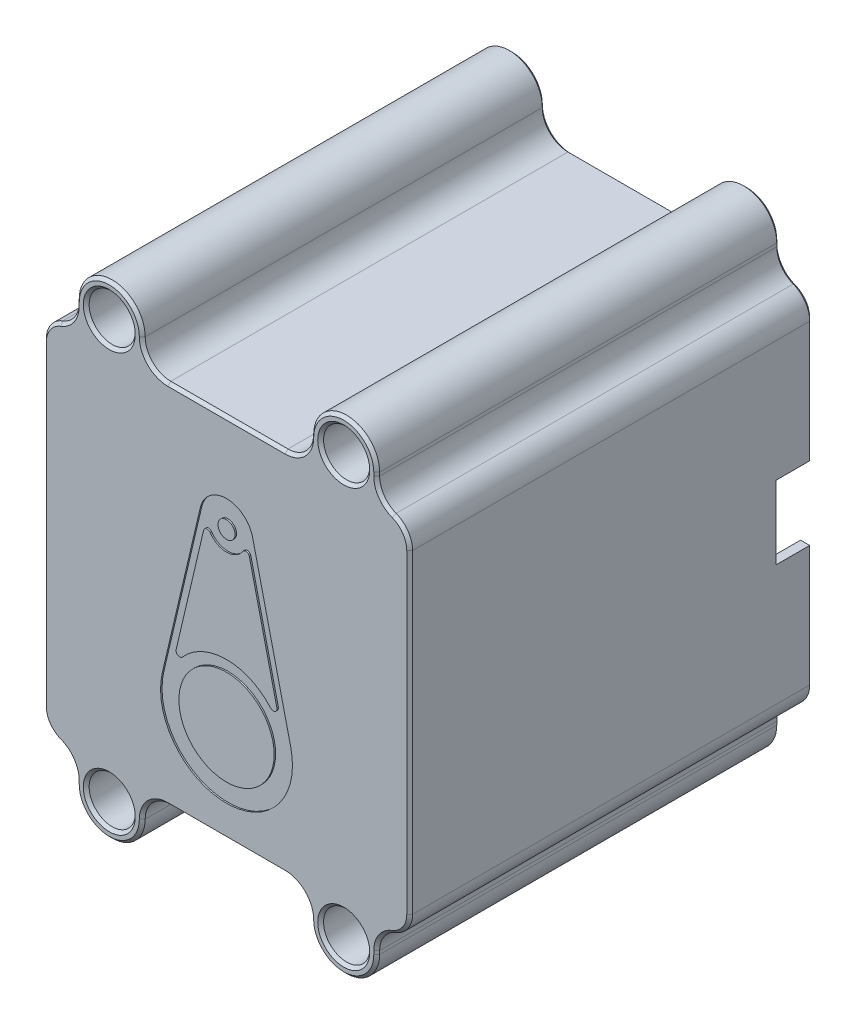
from build123d import *

# Parameters (mm, degrees)
SKIZZE1_W                       = 50
SKIZZE1_H                       = 50
SKIZZE1_W_2                     = 47.5
SKIZZE1_H_2                     = 47.5
AUFSATZ_LINEAR_AUSTRAGEN1_DEPTH = 55
SKIZZE2_W                       = 50
SKIZZE2_H                       = 50
AUFSATZ_LINEAR_AUSTRAGEN2_DEPTH = 1
VERRUNDUNG1_R                   = 3.5
SKIZZE3_W                       = 5
SKIZZE3_H                       = 10
SCHNITT_LINEAR_AUSTRAGEN1_DEPTH = 2
FASE1_SIZE                      = 1
AUFSATZ_LINEAR_START            = -55
SKIZZE4_R                       = 1.8
AUFSATZ_LINEAR_AUSTRAGEN3_DEPTH = 55
SKIZZE5_R                       = 3.15
SCHNITT_LINEAR_AUSTRAGEN2_DEPTH = 49
FASE3_SIZE                      = 0.67
VERRUNDUNG2_R                   = 3.5
FASE2_SIZE                      = 0.4
SKIZZE6_R                       = 6.5
SKIZZE6_R_2                     = 1.166666667
SCHNITT_LINEAR_AUSTRAGEN4_DEPTH = 0.2
VERRUNDUNG3_R                   = 0.5


with BuildPart() as part:
    # Skizze1 → Aufsatz-Linear austragen1 (new body)
    with BuildSketch(Plane.XY):
        Rectangle(SKIZZE1_W, SKIZZE1_H)
        Rectangle(SKIZZE1_W_2, SKIZZE1_H_2, mode=Mode.SUBTRACT)
    extrude(amount=AUFSATZ_LINEAR_AUSTRAGEN1_DEPTH)

    # Skizze2 → Aufsatz-Linear austragen2 (add)
    with BuildSketch(Plane.XY.offset(55)):
        Rectangle(SKIZZE2_W, SKIZZE2_H)
    extrude(amount=-AUFSATZ_LINEAR_AUSTRAGEN2_DEPTH)

    # Verrundung1
    verrundung1_edges = [part.edges().sort_by_distance(p)[0] for p in [
        (-23.75, -23.75, 27),
        (23.75, -23.75, 27),
        (-23.75, 23.75, 27),
        (23.75, 23.75, 27),
        (25, -25, 27.5),
        (-25, -25, 27.5),
        (-25, 25, 27.5),
        (25, 25, 27.5),
    ]]
    fillet(verrundung1_edges, radius=VERRUNDUNG1_R)

    # Skizze3 → Schnitt-Linear austragen1 (cut)
    with BuildSketch(Plane(origin=(25, 0, 0), x_dir=(0, 0, -1), z_dir=(1, 0, 0))):
        with Locations((-2.5, 0)):
            Rectangle(SKIZZE3_W, SKIZZE3_H)
    extrude(amount=-SCHNITT_LINEAR_AUSTRAGEN1_DEPTH, mode=Mode.SUBTRACT)

    # Fase1
    fase1_edges = [part.edges().sort_by_distance(p)[0] for p in [
        (0, -23.75, 54),
        (23.75, 0, 54),
        (-23.75, 0, 54),
        (0, 23.75, 54),
        (22.724873734, 22.724873734, 54),
        (-22.724873734, 22.724873734, 54),
        (-22.724873734, -22.724873734, 54),
        (22.724873734, -22.724873734, 54),
    ]]
    chamfer(fase1_edges, length=FASE1_SIZE)

    # Skizze4 → Aufsatz-Linear austragen3 (add)
    # profile 1 of 6: a face of its own
    with BuildSketch(Plane(origin=(0, 0, 0), x_dir=(-1, 0, 0), z_dir=(0, 0, -1)).offset(AUFSATZ_LINEAR_START)):
        with BuildLine():
            Line((-11.5, 25), (-20.5, 25))
            Line((-20.5, 25), (-21.5, 25))
            ThreePointArc((-21.5, 25), (-23.974873734, 23.974873734), (-25, 21.5))
            Line((-25, 21.5), (-25, 5))
            Line((-25, 5), (-23.75, 5))
            Line((-23.75, 5), (-23.75, 20.25))
            ThreePointArc((-23.75, 20.25), (-22.724873734, 22.724873734), (-20.25, 23.75))
            Line((-20.25, 23.75), (20.25, 23.75))
            ThreePointArc((20.25, 23.75), (22.724873734, 22.724873734), (23.75, 20.25))
            Line((23.75, 20.25), (23.75, -20.25))
            ThreePointArc((23.75, -20.25), (22.724873734, -22.724873734), (20.25, -23.75))
            Line((20.25, -23.75), (-20.25, -23.75))
            ThreePointArc((-20.25, -23.75), (-22.724873734, -22.724873734), (-23.75, -20.25))
            Line((-23.75, -20.25), (-23.75, -5))
            Line((-23.75, -5), (-25, -5))
            Line((-25, -5), (-25, -21.5))
            ThreePointArc((-25, -21.5), (-23.974873734, -23.974873734), (-21.5, -25))
            Line((-21.5, -25), (-20.5, -25))
            Line((-20.5, -25), (-11.5, -25))
            Line((-11.5, -25), (11.5, -25))
            Line((11.5, -25), (20.5, -25))
            Line((20.5, -25), (21.5, -25))
            ThreePointArc((21.5, -25), (23.974873734, -23.974873734), (25, -21.5))
            Line((25, -21.5), (25, 21.5))
            ThreePointArc((25, 21.5), (23.974873734, 23.974873734), (21.5, 25))
            Line((21.5, 25), (20.5, 25))
            Line((20.5, 25), (11.5, 25))
            Line((11.5, 25), (-11.5, 25))
        make_face()
    # profile 2 of 6: a face of its own
    with BuildSketch(Plane(origin=(0, 0, 0), x_dir=(-1, 0, 0), z_dir=(0, 0, -1)).offset(AUFSATZ_LINEAR_START)):
        with BuildLine():
            Line((-11.5, 25), (-20.5, 25))
            Line((-20.5, 25), (-21.5, 25))
            ThreePointArc((-21.5, 25), (-23.974873734, 23.974873734), (-25, 21.5))
            Line((-25, 21.5), (-25, 5))
            Line((-25, 5), (-23.75, 5))
            Line((-23.75, 5), (-23.75, 20.25))
            ThreePointArc((-23.75, 20.25), (-22.724873734, 22.724873734), (-20.25, 23.75))
            Line((-20.25, 23.75), (20.25, 23.75))
            ThreePointArc((20.25, 23.75), (22.724873734, 22.724873734), (23.75, 20.25))
            Line((23.75, 20.25), (23.75, -20.25))
            ThreePointArc((23.75, -20.25), (22.724873734, -22.724873734), (20.25, -23.75))
            Line((20.25, -23.75), (-20.25, -23.75))
            ThreePointArc((-20.25, -23.75), (-22.724873734, -22.724873734), (-23.75, -20.25))
            Line((-23.75, -20.25), (-23.75, -5))
            Line((-23.75, -5), (-25, -5))
            Line((-25, -5), (-25, -21.5))
            ThreePointArc((-25, -21.5), (-23.974873734, -23.974873734), (-21.5, -25))
            Line((-21.5, -25), (-20.5, -25))
            Line((-20.5, -25), (-11.5, -25))
            Line((-11.5, -25), (11.5, -25))
            Line((11.5, -25), (20.5, -25))
            Line((20.5, -25), (21.5, -25))
            ThreePointArc((21.5, -25), (23.974873734, -23.974873734), (25, -21.5))
            Line((25, -21.5), (25, 21.5))
            ThreePointArc((25, 21.5), (23.974873734, 23.974873734), (21.5, 25))
            Line((21.5, 25), (20.5, 25))
            Line((20.5, 25), (11.5, 25))
            Line((11.5, 25), (-11.5, 25))
        make_face()
    # profile 3 of 6: a face of its own
    with BuildSketch(Plane(origin=(0, 0, 0), x_dir=(-1, 0, 0), z_dir=(0, 0, -1)).offset(AUFSATZ_LINEAR_START)):
        with BuildLine():
            ThreePointArc((-11.5, 28.5), (-16, 33), (-20.5, 28.5))
            Line((-20.5, 28.5), (-20.5, 25))
            Line((-20.5, 25), (-11.5, 25))
            Line((-11.5, 25), (-11.5, 28.5))
        make_face()
        with Locations((-16, 28.5)):
            Circle(SKIZZE4_R, mode=Mode.SUBTRACT)
    # profile 4 of 6: a face of its own
    with BuildSketch(Plane(origin=(0, 0, 0), x_dir=(-1, 0, 0), z_dir=(0, 0, -1)).offset(AUFSATZ_LINEAR_START)):
        with BuildLine():
            Line((20.5, -25), (11.5, -25))
            Line((11.5, -25), (11.5, -28.5))
            ThreePointArc((11.5, -28.5), (16, -33), (20.5, -28.5))
            Line((20.5, -28.5), (20.5, -25))
        make_face()
        with Locations((16, -28.5)):
            Circle(SKIZZE4_R, mode=Mode.SUBTRACT)
    # profile 5 of 6: a face of its own
    with BuildSketch(Plane(origin=(0, 0, 0), x_dir=(-1, 0, 0), z_dir=(0, 0, -1)).offset(AUFSATZ_LINEAR_START)):
        with BuildLine():
            Line((11.5, 28.5), (11.5, 25))
            Line((11.5, 25), (20.5, 25))
            Line((20.5, 25), (20.5, 28.5))
            ThreePointArc((20.5, 28.5), (16, 33), (11.5, 28.5))
        make_face()
        with Locations((16, 28.5)):
            Circle(SKIZZE4_R, mode=Mode.SUBTRACT)
    # profile 6 of 6: a face of its own
    with BuildSketch(Plane(origin=(0, 0, 0), x_dir=(-1, 0, 0), z_dir=(0, 0, -1)).offset(AUFSATZ_LINEAR_START)):
        with BuildLine():
            ThreePointArc((-20.5, -28.5), (-16, -33), (-11.5, -28.5))
            Line((-11.5, -28.5), (-11.5, -25))
            Line((-11.5, -25), (-20.5, -25))
            Line((-20.5, -25), (-20.5, -28.5))
        make_face()
        with Locations((-16, -28.5)):
            Circle(SKIZZE4_R, mode=Mode.SUBTRACT)
    extrude(amount=AUFSATZ_LINEAR_AUSTRAGEN3_DEPTH)

    # Skizze5 → Schnitt-Linear austragen2 (cut)
    with BuildSketch(Plane.XY.offset(55)):
        with Locations((-16, 28.5)):
            Circle(SKIZZE5_R)
        with Locations((16, 28.5)):
            Circle(SKIZZE5_R)
        with Locations((16, -28.5)):
            Circle(SKIZZE5_R)
        with Locations((-16, -28.5)):
            Circle(SKIZZE5_R)
    extrude(amount=-SCHNITT_LINEAR_AUSTRAGEN2_DEPTH, mode=Mode.SUBTRACT)

    # Fase3
    fase3_edges = [part.edges().sort_by_distance(p)[0] for p in [
        (-14.2, -28.5, 6),
        (-19.15, -28.5, 6),
        (17.8, -28.5, 6),
        (12.85, -28.5, 6),
        (17.8, 28.5, 6),
        (12.85, 28.5, 6),
        (-14.2, 28.5, 6),
        (-19.15, 28.5, 6),
    ]]
    chamfer(fase3_edges, length=FASE3_SIZE)

    # Verrundung2
    verrundung2_edges = [part.edges().sort_by_distance(p)[0] for p in [
        (11.5, 25, 27.5),
        (20.5, 25, 27.5),
        (20.5, -25, 27.5),
        (11.5, -25, 27.5),
        (-11.5, 25, 27.5),
        (-20.5, 25, 27.5),
        (-20.5, -25, 27.5),
        (-11.5, -25, 27.5),
    ]]
    fillet(verrundung2_edges, radius=VERRUNDUNG2_R - 0.0001)  # a hair under: the kernel refuses the full size

    # Fase2
    fase2_edges = [part.edges().sort_by_distance(p)[0] for p in [
        (25, 13.25, 0),
        (23.75, 12.625, 0),
        (24.375, -5, 0),
        (24.375, 5, 0),
        (17.8, 28.5, 0),
        (16, 33, 0),
        (20.5, 28.269139795, 0),
        (16, 33, 55),
        (-14.2, -28.5, 0),
        (-16, -33, 0),
        (-20.5, -28.269139795, 0),
        (-16, -33, 55),
        (-16, 33, 55),
        (-16, 33, 0),
        (-20.5, 28.269139795, 0),
        (-14.2, 28.5, 0),
        (16, -33, 55),
        (16, -33, 0),
        (20.5, -28.269139795, 0),
        (17.8, -28.5, 0),
        (-19.15, -28.5, 55),
        (12.85, -28.5, 55),
        (12.85, 28.5, 55),
        (-19.15, 28.5, 55),
        (0, 25, 0),
        (0, 25, 55),
        (-24.383130894, 23.484327657, 55),
        (-20.5, 28.269139795, 55),
        (-20.5, -28.269139795, 55),
        (-24.383130894, -23.484327657, 0),
        (0, -25, 0),
        (0, -25, 55),
        (20.5, 28.269139795, 55),
        (24.383130894, 23.484327657, 0),
        (24.383130894, -23.484327657, 55),
        (20.5, -28.269139795, 55),
        (-10.474903023, 26.025096977, 0),
        (-10.474903023, 26.025096977, 55),
        (-21.116851482, 26.054008628, 0),
        (-21.116851482, 26.054008628, 55),
        (-21.116851482, -26.054008628, 0),
        (-21.116851482, -26.054008628, 55),
        (-10.474903023, -26.025096977, 0),
        (-10.474903023, -26.025096977, 55),
        (10.474903023, 26.025096977, 0),
        (10.474903023, 26.025096977, 55),
        (21.116851482, 26.054008628, 0),
        (21.116851482, 26.054008628, 55),
        (21.116851482, -26.054008628, 0),
        (21.116851482, -26.054008628, 55),
        (10.474903023, -26.025096977, 0),
        (10.474903023, -26.025096977, 55),
        (0, -23.75, 0),
        (23.75, -12.625, 0),
        (-23.75, 0, 0),
        (0, 23.75, 0),
        (-25, 0, 0),
        (-25, 0, 55),
        (25, -13.25, 0),
        (24.383130894, -23.484327657, 0),
        (-24.383130894, 23.484327657, 0),
        (25, 0, 55),
        (-24.383130894, -23.484327657, 55),
        (24.383130894, 23.484327657, 55),
        (22.724873734, -22.724873734, 0),
        (-22.724873734, -22.724873734, 0),
        (-22.724873734, 22.724873734, 0),
        (22.724873734, 22.724873734, 0),
    ]]
    chamfer(fase2_edges, length=FASE2_SIZE)

    # Skizze6 → Schnitt-Linear austragen4 (cut)
    with BuildSketch(Plane.XY.offset(55)):
        with BuildLine():
            Line((-8.762210109, -9.622776897), (-3.569789304, 12.515221354))
            ThreePointArc((-3.569789304, 12.515221354), (0, 15.344601467), (3.569789304, 12.515221354))
            Line((3.569789304, 12.515221354), (8.762210109, -9.622776897))
            ThreePointArc((8.762210109, -9.622776897), (0, -20.677934801), (-8.762210109, -9.622776897))
        make_face()
        with Locations((0, -11.677934801)):
            Circle(SKIZZE6_R, mode=Mode.SUBTRACT)
        with Locations((0, 11.677934801)):
            Circle(SKIZZE6_R_2, mode=Mode.SUBTRACT)
        with BuildLine():
            Line((-6.847116418, -5.836959132), (-2.596210403, 12.286870476))
            ThreePointArc((-2.596210403, 12.286870476), (0, 9.011268134), (2.596210403, 12.286870476))
            Line((2.596210403, 12.286870476), (7.788631208, -9.851127775))
            ThreePointArc((7.788631208, -9.851127775), (0, -3.677934801), (-7.788631208, -9.851127775))
            Line((-7.788631208, -9.851127775), (-6.847116418, -5.836959132))
        make_face(mode=Mode.SUBTRACT)
    extrude(amount=-SCHNITT_LINEAR_AUSTRAGEN4_DEPTH, mode=Mode.SUBTRACT)

    # Verrundung3
    verrundung3_edges = [part.edges().sort_by_distance(p)[0] for p in [
        (-2.596210403, 12.286870476, 54.9),
    ]]
    fillet(verrundung3_edges, radius=VERRUNDUNG3_R)
    verrundung3_2_edges = [part.edges().sort_by_distance(p)[0] for p in [
        (7.788631208, -9.851127775, 54.9),
    ]]
    fillet(verrundung3_2_edges, radius=VERRUNDUNG3_R)
    verrundung3_3_edges = [part.edges().sort_by_distance(p)[0] for p in [
        (2.596210403, 12.286870476, 54.9),
    ]]
    fillet(verrundung3_3_edges, radius=VERRUNDUNG3_R)
    verrundung3_4_edges = [part.edges().sort_by_distance(p)[0] for p in [
        (-7.788631208, -9.851127775, 54.9),
    ]]
    fillet(verrundung3_4_edges, radius=VERRUNDUNG3_R)


solid = part.part
